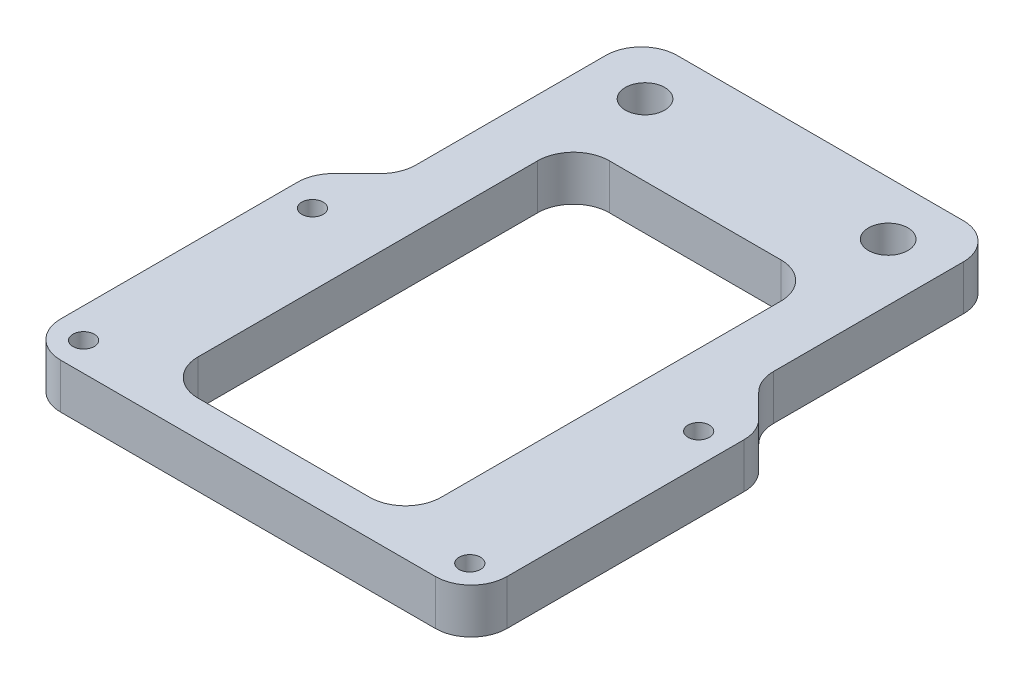
from build123d import *

# Parameters (mm, degrees)
SKETCH1_W           = 39.624
SKETCH1_H           = 25.4
SKETCH1_R           = 0.95
BOSS_EXTRUDE1_DEPTH = 4
SKETCH3_W           = 31.75
SKETCH3_H           = 25.4
SKETCH3_R           = 1.75
BOSS_EXTRUDE2_DEPTH = 4
SKETCH5_W           = 21.59
SKETCH5_H           = 36.5125
CUT_EXTRUDE2_DEPTH  = 44.129170453
CHAMFER1_SIZE       = 4.064
FILLET2_R           = 3.175


with BuildPart() as part:
    # Sketch1 → Boss-Extrude1 (new body)
    with BuildSketch(Plane(origin=(0, 0, 0), x_dir=(1, 0, 0), z_dir=(0, 1, 0))):
        Rectangle(SKETCH1_W, SKETCH1_H)
        with Locations(Location((-17.145, 10.16, 0), (0, 0, 270))):
            Circle(SKETCH1_R, mode=Mode.SUBTRACT)
        with Locations(Location((-17.145, -10.16, 0), (0, 0, 270))):
            Circle(SKETCH1_R, mode=Mode.SUBTRACT)
        with Locations(Location((17.145, -10.16, 0), (0, 0, 270))):
            Circle(SKETCH1_R, mode=Mode.SUBTRACT)
        with Locations(Location((17.145, 10.16, 0), (0, 0, 270))):
            Circle(SKETCH1_R, mode=Mode.SUBTRACT)
    extrude(amount=BOSS_EXTRUDE1_DEPTH)

    # Sketch3 → Boss-Extrude2 (add)
    with BuildSketch(Plane.XZ):
        with Locations((0, -25.4)):
            Rectangle(SKETCH3_W, SKETCH3_H)
        with Locations(Location((-10.795, -33.3375, 0), (0, 0, 270))):
            Circle(SKETCH3_R, mode=Mode.SUBTRACT)
        with Locations(Location((10.795, -33.3375, 0), (0, 0, 270))):
            Circle(SKETCH3_R, mode=Mode.SUBTRACT)
    extrude(amount=-BOSS_EXTRUDE2_DEPTH)

    # Sketch5 → Cut-Extrude2 (cut, through all)
    with BuildSketch(Plane.XZ):
        with Locations((0, -8.73125)):
            Rectangle(SKETCH5_W, SKETCH5_H)
    extrude(amount=-CUT_EXTRUDE2_DEPTH, mode=Mode.SUBTRACT)

    # Chamfer1
    # the kernel refuses this chamfer: 4.064 mm, written as the material it adds along each edge
    with BuildSketch(Plane(origin=(15.875, 0, -12.7), x_dir=(0.9996219169112968, 0, 0.027495876610586435), z_dir=(0, 1, 0))) as chamfer1_piece_1_section:
        Polygon((CHAMFER1_SIZE * 0.999621916911, CHAMFER1_SIZE * 0.0274958766106), (-CHAMFER1_SIZE * 0.0274958766106, CHAMFER1_SIZE * 0.999621916911), (0, 0), align=None)
    chamfer1_piece_1 = extrude(amount=4, mode=Mode.PRIVATE)
    chamfer1_piece_1 = split(chamfer1_piece_1, bisect_by=Plane(origin=(19.812, 2, -14.047586344), z_dir=(-1, 0, 0)), keep=Keep.TOP, mode=Mode.PRIVATE)
    add(chamfer1_piece_1)
    with BuildSketch(Plane(origin=(-15.875, 0, -12.7), x_dir=(-0.9996219169112968, 0, 0.027495876610586455), z_dir=(0, 1, 0))) as chamfer1_piece_2_section:
        Polygon((CHAMFER1_SIZE * 0.999621916911, -CHAMFER1_SIZE * 0.0274958766106), (-CHAMFER1_SIZE * 0.0274958766106, -CHAMFER1_SIZE * 0.999621916911), (0, 0), align=None)
    chamfer1_piece_2 = extrude(amount=4, mode=Mode.PRIVATE)
    chamfer1_piece_2 = split(chamfer1_piece_2, bisect_by=Plane(origin=(-19.812, 2, -14.047586344), z_dir=(1, 0, 0)), keep=Keep.TOP, mode=Mode.PRIVATE)
    add(chamfer1_piece_2)

    # Fillet2
    fillet2_edges = [part.edges().sort_by_distance(p)[0] for p in [
        (15.875, 2, -38.1),
        (-15.875, 2, -38.1),
        (10.795, 2, 9.525),
        (10.795, 2, -26.9875),
        (-10.795, 2, -26.9875),
        (-10.795, 2, 9.525),
        (15.875, 2, -16.764),
        (-15.875, 2, -16.764),
        (19.812, 2, -12.827),
        (-19.812, 2, -12.827),
        (19.812, 2, 12.7),
        (-19.812, 2, 12.7),
    ]]
    fillet(fillet2_edges, radius=FILLET2_R)


solid = part.part
